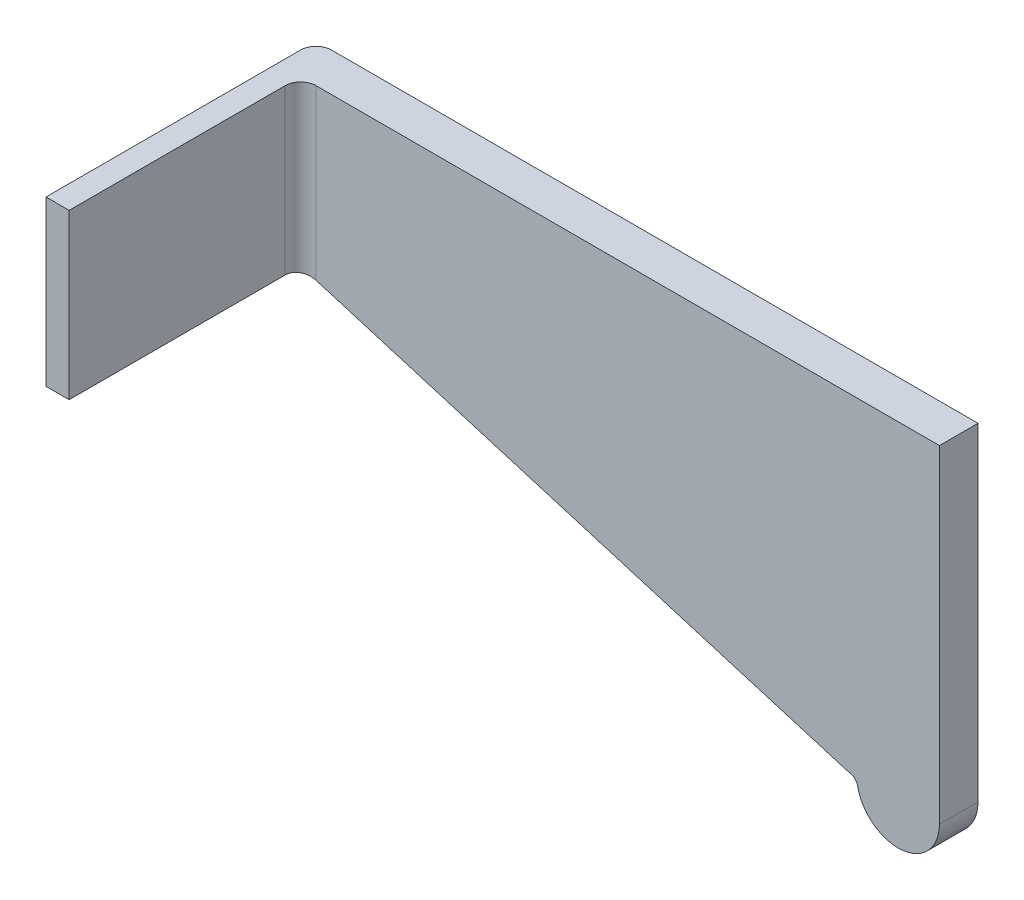
from build123d import *

# Parameters (mm, degrees)
ESTRUSIONE_ESTRUSIONE1_DEPTH = 5
SCHIZZO2_W                   = 72.109898292
SCHIZZO2_H                   = 42.507089678
ESTRUSIONE_ESTRUSIONE2_DEPTH = 5
SCHIZZO3_W                   = 10.696209694
SCHIZZO3_H                   = 5.348104847
ESTRUSIONE_ESTRUSIONE3_DEPTH = 5
RACCORDO1_R                  = 1.275157777
TAGLIO_ESTRUSIONE1_DEPTH     = 5
SCHIZZO6_W                   = 21.26
SCHIZZO6_H                   = 3
ESTRUSIONE_ESTRUSIONE4_DEPTH = 35
RACCORDO9_DEPTH              = 5
RACCORDO14_R                 = 2
RACCORDO15_R                 = 2


with BuildPart() as part:
    # Schizzo1 → Estrusione-Estrusione1 (new body)
    with BuildSketch(Plane.XY):
        with BuildLine():
            Line((-5.348104847, 0), (-5.348104847, 37.158984831))
            ThreePointArc((-5.348104847, 37.158984831), (0, 42.507089678), (5.348104847, 37.158984831))
            Line((5.348104847, 37.158984831), (5.348104847, 0))
            ThreePointArc((5.348104847, 0), (0, -5.348104847), (-5.348104847, 0))
        make_face()
    extrude(amount=ESTRUSIONE_ESTRUSIONE1_DEPTH)

    # Schizzo2 → Estrusione-Estrusione2 (add)
    with BuildSketch(Plane.XY):
        with Locations((-41.403053993, 21.253544839)):
            Rectangle(SCHIZZO2_W, SCHIZZO2_H)
    extrude(amount=ESTRUSIONE_ESTRUSIONE2_DEPTH)

    # Schizzo3 → Estrusione-Estrusione3 (add)
    with BuildSketch(Plane.XY.offset(5)):
        with Locations((0, 39.833037254)):
            Rectangle(SCHIZZO3_W, SCHIZZO3_H)
    extrude(amount=-ESTRUSIONE_ESTRUSIONE3_DEPTH)

    # Raccordo1
    raccordo1_edges = [part.edges().sort_by_distance(p)[0] for p in [
        (-5.348104847, 0, 2.5),
    ]]
    fillet(raccordo1_edges, radius=RACCORDO1_R)

    # Schizzo5 → Taglio-Estrusione1 (cut)
    with BuildSketch(Plane.XY.offset(5)):
        Polygon((-77.458003139, 21.253544839), (-6.499352309, 0), (-77.458003139, 0), align=None)
    extrude(amount=-TAGLIO_ESTRUSIONE1_DEPTH, mode=Mode.SUBTRACT)

    # Schizzo6 → Estrusione-Estrusione4 (add)
    with BuildSketch(Plane(origin=(0, 0, 0), x_dir=(0, -1, 0), z_dir=(0, 0, -1))):
        with Locations((-31.877089678, 78.958003139)):
            Rectangle(SCHIZZO6_W, SCHIZZO6_H)
    extrude(amount=-ESTRUSIONE_ESTRUSIONE4_DEPTH)

    # Raccordo9: read off the stored shape, not the designer's step
    # Raccordo9 outline → Raccordo9 (add)
    with BuildSketch(Plane.XY):
        with BuildLine():
            ThreePointArc((-78.02262727, 21.247089678), (-77.442645969, 21.204819039), (-76.874922759, 21.078900524))
            Line((-76.874922759, 21.078900524), (-77.458003139, 21.253544839))
            Line((-77.458003139, 21.253544839), (-77.458003139, 21.247089678))
            Line((-77.458003139, 21.247089678), (-78.02262727, 21.247089678))
        make_face()
    extrude(amount=RACCORDO9_DEPTH)

    # Raccordo14
    raccordo14_edges = [part.edges().sort_by_distance(p)[0] for p in [
        (-80.458003139, 31.877089678, 0),
    ]]
    fillet(raccordo14_edges, radius=RACCORDO14_R)

    # Raccordo15
    # the kernel refuses this fillet: 2 mm, written as the material it adds along each edge
    with BuildSketch(Plane(origin=(-77.458003139, 42.507089678, 5), x_dir=(1, 0, 0), z_dir=(0, -1, 0))) as raccordo15_piece_1:
        with BuildLine():
            CenterArc((RACCORDO15_R, RACCORDO15_R), RACCORDO15_R, 180, 90)
            Line((0, RACCORDO15_R), (0, 0))
            Line((0, 0), (RACCORDO15_R, 0))
        make_face()
    extrude(amount=21.253544839)
    with BuildSketch(Plane(origin=(-77.458003139, 21.253544839, 5), x_dir=(1, 0, 0), z_dir=(0, -1, 0))) as raccordo15_piece_2_section:
        with BuildLine():
            CenterArc((RACCORDO15_R, RACCORDO15_R), RACCORDO15_R, 180, 90)
            Line((RACCORDO15_R * 9.50990397541e-11, RACCORDO15_R), (0, 0))
            Line((0, 0), (RACCORDO15_R, 0))
        make_face()
    raccordo15_piece_2 = extrude(amount=5.006455161, mode=Mode.PRIVATE)
    raccordo15_piece_2 = split(raccordo15_piece_2, bisect_by=Plane(origin=(-77.458003139, 21.253544839, 5), z_dir=(0.2869261276439439, 0.957952711398246, 0)), keep=Keep.TOP, mode=Mode.PRIVATE)
    add(raccordo15_piece_2)


solid = part.part
